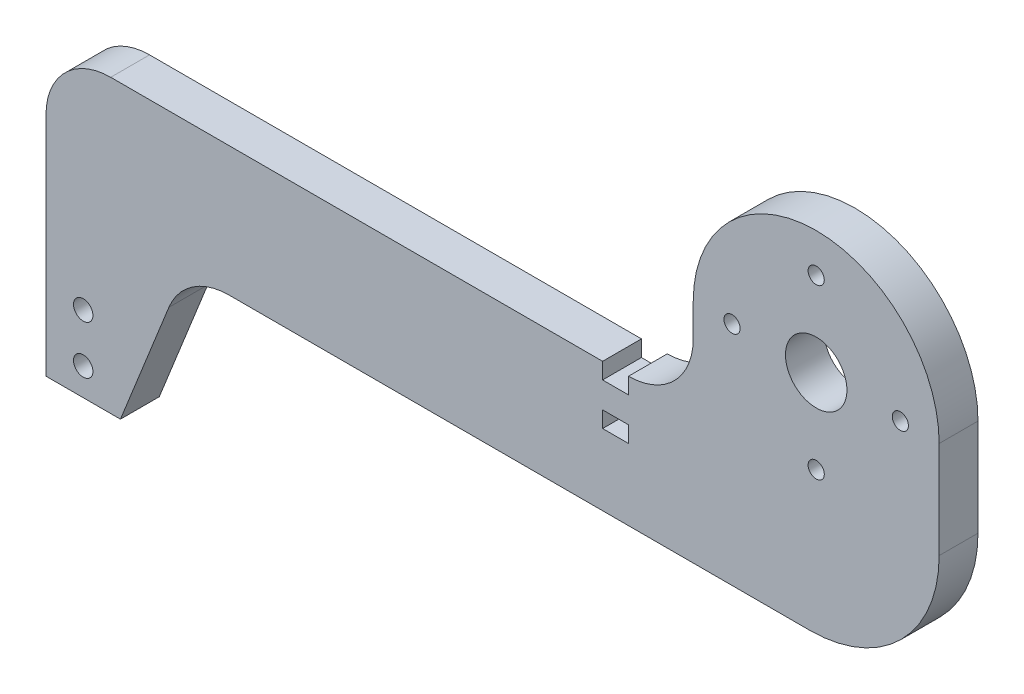
from build123d import *

# Parameters (mm, degrees)
SKETCH_1_W      = 4
SKETCH_1_H      = 2.5
SKETCH_1_R      = 1.25
SKETCH_1_R_2    = 4.75
SKETCH_1_R_3    = 1.5
EXTRUDE_1_DEPTH = 6
FILLET_1_R      = 10
FILLET_2_R      = 20
FILLET_3_R      = 10


with BuildPart() as part:
    # Эскиз1 → Бобышка-Вытянуть1 (new body)
    with BuildSketch(Plane.XY):
        with BuildLine():
            Line((19, -35), (19, 0))
            ThreePointArc((19, 0), (0, 19), (-19, 0))
            Line((-19, 0), (-19, -15))
            Line((-19, -15), (-29, -15))
            Line((-29, -15), (-29, -17.5))
            Line((-29, -17.5), (-33, -17.5))
            Line((-33, -17.5), (-33, -15))
            Line((-33, -15), (-119, -15))
            Line((-119, -15), (-119, -60))
            Line((-119, -60), (-107.5, -60))
            Line((-107.5, -60), (-97.5, -35))
            Line((-97.5, -35), (19, -35))
        make_face()
        with Locations((-31, -22.75)):
            Rectangle(SKETCH_1_W, SKETCH_1_H, mode=Mode.SUBTRACT)
        with Locations((0, -13)):
            Circle(SKETCH_1_R, mode=Mode.SUBTRACT)
        with Locations((-13, 0)):
            Circle(SKETCH_1_R, mode=Mode.SUBTRACT)
        Circle(SKETCH_1_R_2, mode=Mode.SUBTRACT)
        with Locations((13, 0)):
            Circle(SKETCH_1_R, mode=Mode.SUBTRACT)
        with Locations((0, 13)):
            Circle(SKETCH_1_R, mode=Mode.SUBTRACT)
        with Locations((-113.25, -55.75)):
            Circle(SKETCH_1_R_3, mode=Mode.SUBTRACT)
        with Locations((-113.25, -48.25)):
            Circle(SKETCH_1_R_3, mode=Mode.SUBTRACT)
    extrude(amount=EXTRUDE_1_DEPTH)

    # Скругление1
    fillet_1_edges = [part.edges().sort_by_distance(p)[0] for p in [
        (-19, -15, 3),
    ]]
    fillet(fillet_1_edges, radius=FILLET_1_R - 0.0001)  # a hair under: the kernel refuses the full size

    # Скругление2
    fillet_2_edges = [part.edges().sort_by_distance(p)[0] for p in [
        (19, -35, 3),
    ]]
    fillet(fillet_2_edges, radius=FILLET_2_R)

    # Скругление3
    fillet_3_edges = [part.edges().sort_by_distance(p)[0] for p in [
        (-119, -15, 3),
        (-97.5, -35, 3),
    ]]
    fillet(fillet_3_edges, radius=FILLET_3_R)


solid = part.part
